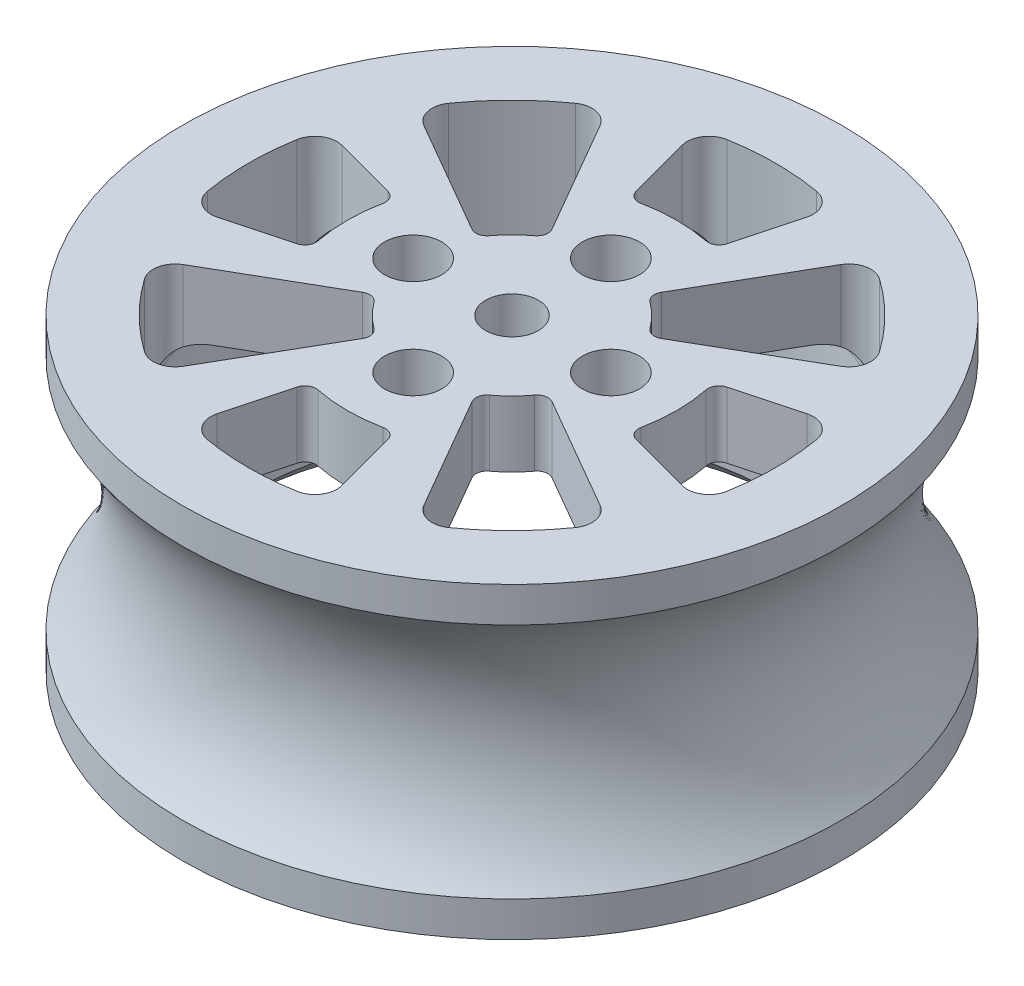
from build123d import *

# Parameters (mm, degrees)
M2_CLEARANCE_HOLE1_D = 2.6
CUT_EXTRUDE1_START   = -5.0000001
CUT_EXTRUDE1_DEPTH   = 5.0000001
CHAMFER1_SIZE        = 1


# Read off the part's stored shape, not the designer's step: Cut-Extrude1
with BuildPart() as part:
    # Sketch1 → Revolve1 (revolve)
    with BuildSketch(Plane.XY, mode=Mode.PRIVATE) as revolve1_sk:
        with BuildLine():
            Line((-0.1384665388769202, 3.8749999999999973), (8.66153346112308, 3.8749999999999982))
            ThreePointArc((8.66153346112308, 3.8749999999999982), (10.075747023496175, 3.289213562373093), (10.661533461123081, 1.874999999999998))
            Line((10.661533461123081, 1.874999999999998), (10.661533461123081, -7.125000000000003))
            Line((10.661533461123081, -7.125000000000003), (13.66153346112308, -7.125000000000003))
            Line((13.66153346112308, -7.125000000000003), (13.661533461123074, -5.524999999999995))
            ThreePointArc((13.661533461123074, -5.524999999999995), (12.323383778668454, -2.9710498941515384), (11.86153346112308, -0.12500000000000358))
            ThreePointArc((11.86153346112308, -0.12500000000000358), (12.323383778668454, 2.721049894151534), (13.661533461123074, 5.274999999999989))
            Line((13.661533461123074, 5.274999999999989), (13.66153346112308, 6.874999999999997))
            Line((13.66153346112308, 6.874999999999997), (-0.1384665388769206, 6.874999999999996))
            Line((-0.1384665388769206, 6.874999999999996), (-0.1384665388769202, 3.8749999999999973))
        make_face()
    revolve(revolve1_sk.sketch.rotate(Axis((-1.3384665388769221, 6.874999999999996, 0), (0, -1, 0)), 90), axis=Axis((-1.3384665388769221, 6.874999999999996, 0), (0, -1, 0)))

    # M2 Clearance Hole1 (through all)
    with Locations(Plane(origin=(0, 6.8749999999999964, 0), x_dir=(1, 3e-17, 0), z_dir=(-3e-17, 1, 0))):
        with Locations((-5.838466539, 0), (-1.338466539, 4.5), (3.161533461, 0), (-1.338466539, -4.5)):
            Hole(M2_CLEARANCE_HOLE1_D / 2)

    # Cut-Extrude1 outline → Cut-Extrude1 (cut)
    with BuildSketch(Plane(origin=(0, 6.8749999999999964, 0), x_dir=(1, 3e-17, 0), z_dir=(-3e-17, 1, 0)).offset(CUT_EXTRUDE1_START)):
        with BuildLine():
            ThreePointArc((10.486994905, -2.039230647), (10.661533461, 0), (10.486994905, 2.039230647))
            ThreePointArc((10.486994905, 2.039230647), (10.040427521, 2.711672352), (9.24272074, 2.835220586))
            Line((9.24272074, 2.835220586), (6.373832713, 2.066504356))
            ThreePointArc((6.373832713, 2.066504356), (6.078257545, 1.846957489), (6.013135437, 1.484570103))
            ThreePointArc((6.013135437, 1.484570103), (6.161533461, 0), (6.013135437, -1.484570103))
            ThreePointArc((6.013135437, -1.484570103), (6.078257545, -1.846957489), (6.373832713, -2.066504356))
            Line((6.373832713, -2.066504356), (9.24272074, -2.835220586))
            ThreePointArc((9.24272074, -2.835220586), (10.040427521, -2.711672352), (10.486994905, -2.039230647))
        make_face()
        with BuildLine():
            ThreePointArc((8.148366442, 5.477225575), (8.625068522, 6.128651244), (8.465351258, 6.919910159))
            ThreePointArc((8.465351258, 6.919910159), (7.146814835, 8.485281374), (5.58144362, 9.803817797))
            ThreePointArc((5.58144362, 9.803817797), (4.790184705, 9.963535061), (4.138759036, 9.486832981))
            Line((4.138759036, 9.486832981), (1.149002054, 4.308421985))
            ThreePointArc((1.149002054, 4.308421985), (1.093178843, 3.953353196), (1.289966626, 3.652579786))
            ThreePointArc((1.289966626, 3.652579786), (1.843513976, 3.181980515), (2.314113248, 2.628433165))
            ThreePointArc((2.314113248, 2.628433165), (2.614886658, 2.431645382), (2.969955446, 2.487468593))
            Line((2.969955446, 2.487468593), (8.148366442, 5.477225575))
        make_face()
        with BuildLine():
            ThreePointArc((5.58144362, -9.803817797), (7.146814835, -8.485281374), (8.465351258, -6.919910159))
            ThreePointArc((8.465351258, -6.919910159), (8.625068522, -6.128651244), (8.148366442, -5.477225575))
            Line((8.148366442, -5.477225575), (2.969955446, -2.487468593))
            ThreePointArc((2.969955446, -2.487468593), (2.614886658, -2.431645382), (2.314113248, -2.628433165))
            ThreePointArc((2.314113248, -2.628433165), (1.843513976, -3.181980515), (1.289966626, -3.652579786))
            ThreePointArc((1.289966626, -3.652579786), (1.093178843, -3.953353196), (1.149002054, -4.308421985))
            Line((1.149002054, -4.308421985), (4.138759036, -9.486832981))
            ThreePointArc((4.138759036, -9.486832981), (4.790184705, -9.963535061), (5.58144362, -9.803817797))
        make_face()
        with BuildLine():
            ThreePointArc((1.496754047, 10.581187279), (1.373205813, 11.37889406), (0.700764108, 11.825461444))
            ThreePointArc((0.700764108, 11.825461444), (-1.338466539, 12), (-3.377697186, 11.825461444))
            ThreePointArc((-3.377697186, 11.825461444), (-4.050138891, 11.37889406), (-4.173687125, 10.581187279))
            Line((-4.173687125, 10.581187279), (-3.404970895, 7.712299252))
            ThreePointArc((-3.404970895, 7.712299252), (-3.185424028, 7.416724084), (-2.823036642, 7.351601976))
            ThreePointArc((-2.823036642, 7.351601976), (-1.338466539, 7.5), (0.146103564, 7.351601976))
            ThreePointArc((0.146103564, 7.351601976), (0.50849095, 7.416724084), (0.728037817, 7.712299252))
            Line((0.728037817, 7.712299252), (1.496754047, 10.581187279))
        make_face()
        with BuildLine():
            ThreePointArc((-3.377697186, -11.825461444), (-1.338466539, -12), (0.700764108, -11.825461444))
            ThreePointArc((0.700764108, -11.825461444), (1.373205813, -11.37889406), (1.496754047, -10.581187279))
            Line((1.496754047, -10.581187279), (0.728037817, -7.712299252))
            ThreePointArc((0.728037817, -7.712299252), (0.50849095, -7.416724084), (0.146103564, -7.351601976))
            ThreePointArc((0.146103564, -7.351601976), (-1.338466539, -7.5), (-2.823036642, -7.351601976))
            ThreePointArc((-2.823036642, -7.351601976), (-3.185424028, -7.416724084), (-3.404970895, -7.712299252))
            Line((-3.404970895, -7.712299252), (-4.173687125, -10.581187279))
            ThreePointArc((-4.173687125, -10.581187279), (-4.050138891, -11.37889406), (-3.377697186, -11.825461444))
        make_face()
        with BuildLine():
            ThreePointArc((-6.815692114, 9.486832981), (-7.467117783, 9.963535061), (-8.258376698, 9.803817797))
            ThreePointArc((-8.258376698, 9.803817797), (-9.823747913, 8.485281374), (-11.142284336, 6.919910159))
            ThreePointArc((-11.142284336, 6.919910159), (-11.3020016, 6.128651244), (-10.825299519, 5.477225575))
            Line((-10.825299519, 5.477225575), (-5.646888524, 2.487468593))
            ThreePointArc((-5.646888524, 2.487468593), (-5.291819735, 2.431645382), (-4.991046325, 2.628433165))
            ThreePointArc((-4.991046325, 2.628433165), (-4.520447054, 3.181980515), (-3.966899704, 3.652579786))
            ThreePointArc((-3.966899704, 3.652579786), (-3.770111921, 3.953353196), (-3.825935132, 4.308421985))
            Line((-3.825935132, 4.308421985), (-6.815692114, 9.486832981))
        make_face()
        with BuildLine():
            ThreePointArc((-11.142284336, -6.919910159), (-9.823747913, -8.485281374), (-8.258376698, -9.803817797))
            ThreePointArc((-8.258376698, -9.803817797), (-7.467117783, -9.963535061), (-6.815692114, -9.486832981))
            Line((-6.815692114, -9.486832981), (-3.825935132, -4.308421985))
            ThreePointArc((-3.825935132, -4.308421985), (-3.770111921, -3.953353196), (-3.966899704, -3.652579786))
            ThreePointArc((-3.966899704, -3.652579786), (-4.520447054, -3.181980515), (-4.991046325, -2.628433165))
            ThreePointArc((-4.991046325, -2.628433165), (-5.291819735, -2.431645382), (-5.646888524, -2.487468593))
            Line((-5.646888524, -2.487468593), (-10.825299519, -5.477225575))
            ThreePointArc((-10.825299519, -5.477225575), (-11.3020016, -6.128651244), (-11.142284336, -6.919910159))
        make_face()
        with BuildLine():
            ThreePointArc((-11.919653818, 2.835220586), (-12.717360599, 2.711672352), (-13.163927983, 2.039230647))
            ThreePointArc((-13.163927983, 2.039230647), (-13.338466539, 0), (-13.163927983, -2.039230647))
            ThreePointArc((-13.163927983, -2.039230647), (-12.717360599, -2.711672352), (-11.919653818, -2.835220586))
            Line((-11.919653818, -2.835220586), (-9.05076579, -2.066504356))
            ThreePointArc((-9.05076579, -2.066504356), (-8.755190623, -1.846957489), (-8.690068515, -1.484570103))
            ThreePointArc((-8.690068515, -1.484570103), (-8.838466539, 0), (-8.690068515, 1.484570103))
            ThreePointArc((-8.690068515, 1.484570103), (-8.755190623, 1.846957489), (-9.05076579, 2.066504356))
            Line((-9.05076579, 2.066504356), (-11.919653818, 2.835220586))
        make_face()
    extrude(amount=CUT_EXTRUDE1_DEPTH, mode=Mode.SUBTRACT)

    # Chamfer1
    chamfer1_edges = [part.edges().sort_by_distance(p)[0] for p in [
        (-1.3384665388769197, -7.125000000000003, -12.000000000000004),
    ]]
    chamfer(chamfer1_edges, length=CHAMFER1_SIZE)


solid = part.part
